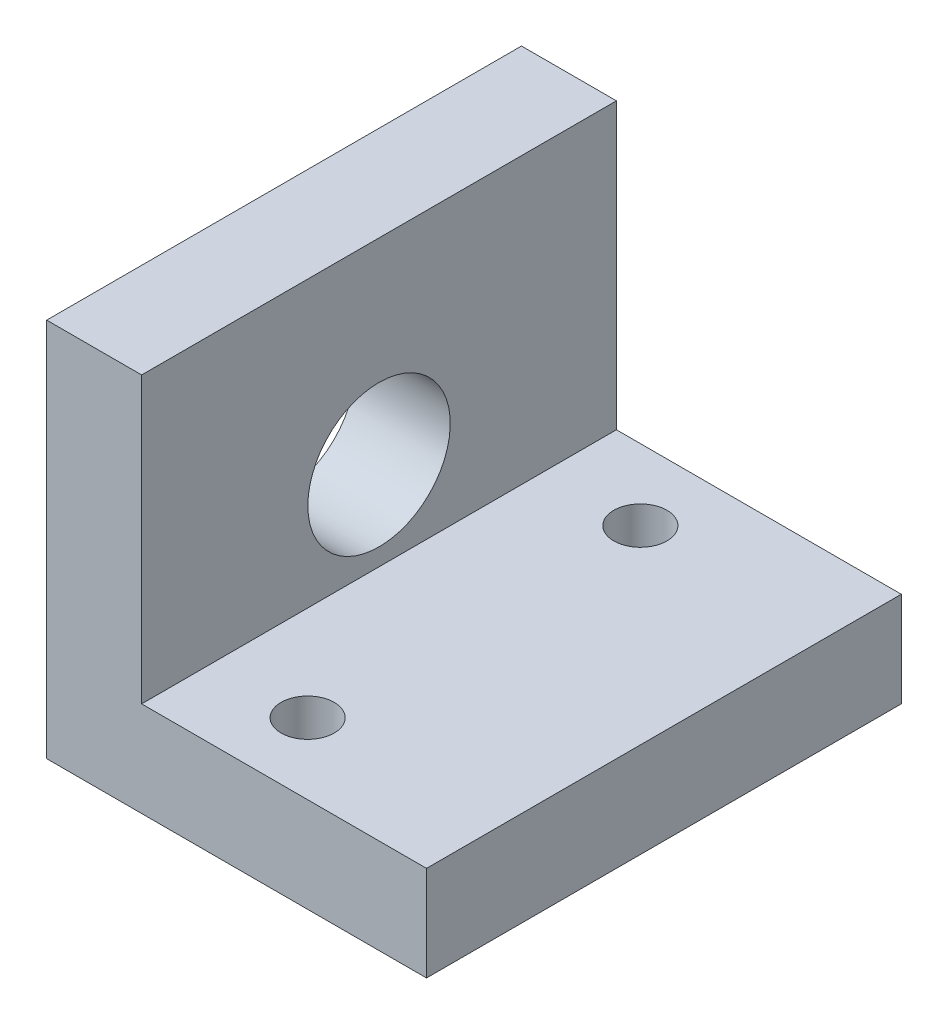
from build123d import *

# Parameters (mm, degrees)
BOSS_EXTRUDE1_DEPTH = 31.75
SKETCH2_R           = 4.7625
CUT_EXTRUDE1_DEPTH  = 48.941448664
SKETCH3_R           = 1.778
CUT_EXTRUDE2_DEPTH  = 45.901280605


with BuildPart() as part:
    # Sketch1 → Boss-Extrude1 (new body)
    with BuildSketch(Plane.XY):
        Polygon((0, 0), (0, 25.4), (6.35, 25.4), (6.35, 6.35), (25.4, 6.35), (25.4, 0), align=None)
    extrude(amount=-BOSS_EXTRUDE1_DEPTH)

    # Sketch2 → Cut-Extrude1 (cut, through all)
    with BuildSketch(Plane.ZY):
        with Locations((-15.875, 12.2682)):
            Circle(SKETCH2_R)
    extrude(amount=-CUT_EXTRUDE1_DEPTH, mode=Mode.SUBTRACT)

    # Sketch3 → Cut-Extrude2 (cut, through all)
    with BuildSketch(Plane(origin=(0, 6.35, 0), x_dir=(1, 0, 0), z_dir=(0, 1, 0))):
        with Locations((12.7, 27.0002)):
            Circle(SKETCH3_R)
        with Locations((12.7, 4.7498)):
            Circle(SKETCH3_R)
    extrude(amount=-CUT_EXTRUDE2_DEPTH, mode=Mode.SUBTRACT)


solid = part.part
